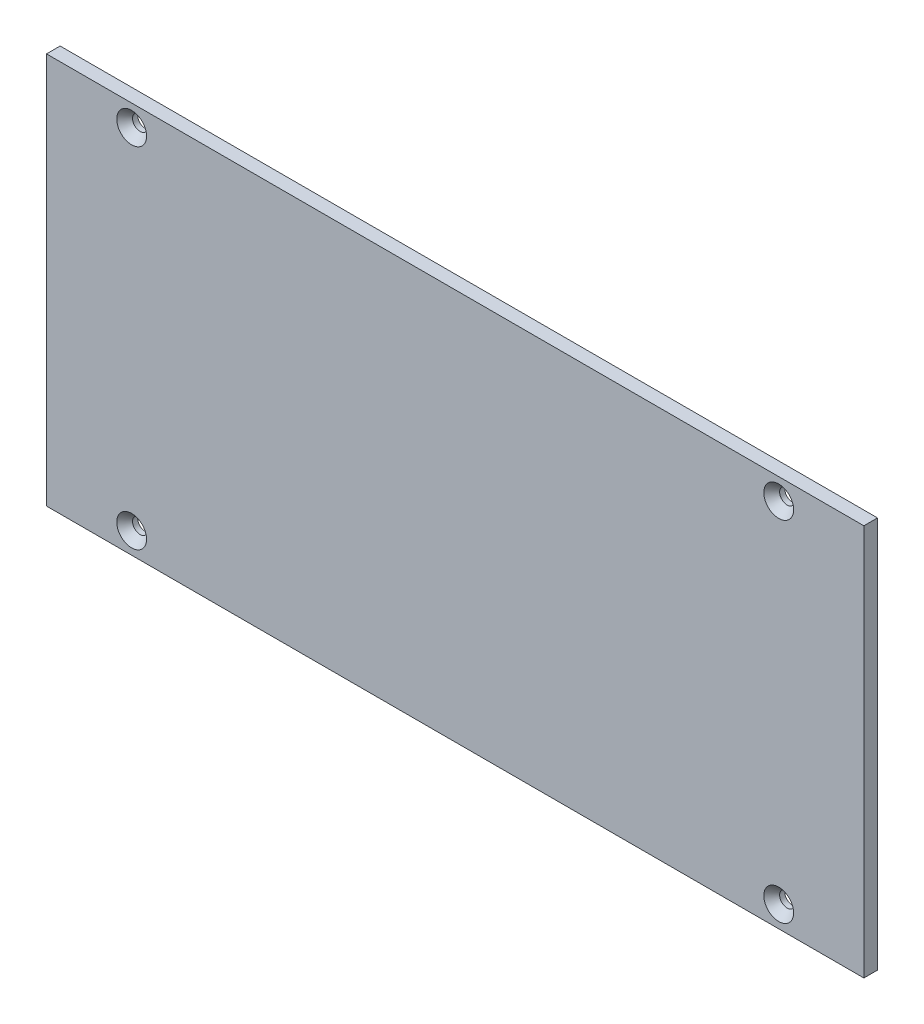
from build123d import *

# Parameters (mm, degrees)
SKETCH1_W                                     = 96
SKETCH1_H                                     = 46
BOSS_EXTRUDE1_DEPTH                           = 1.6002
CSK_FOR_0_FLAT_HEAD_SOCKET_CAP_SCREW1_A_COUNT = 2
CSK_FOR_0_FLAT_HEAD_SOCKET_CAP_SCREW1_A_PITCH = 41
CSK_FOR_0_FLAT_HEAD_SOCKET_CAP_SCRE_2_COUNT   = 2
CSK_FOR_0_FLAT_HEAD_SOCKET_CAP_SCRE_2_PITCH   = 86.353922899
CSK_FOR_0_FLAT_HEAD_SOCKET_CAP_SCRE_3_COUNT   = 2
CSK_FOR_0_FLAT_HEAD_SOCKET_CAP_SCRE_3_PITCH   = 76


with BuildPart() as part:
    # Sketch1 → Boss-Extrude1 (new body)
    with BuildSketch(Plane.XY):
        with Locations((48, 23)):
            Rectangle(SKETCH1_W, SKETCH1_H)
    extrude(amount=BOSS_EXTRUDE1_DEPTH)

    # Sketch7 → CSK for #0 Flat Head Socket Cap Screw1 (revolve, cut)
    with BuildSketch(Plane(origin=(10, 43.5, 1.6002), x_dir=(0, -1, 0), z_dir=(1, 0, 0))):
        Polygon((0, 0), (0, 1.6002), (0.889, 1.6002), (0.889, 0.993458156), (1.7526, 0), align=None)
    csk_for_0_flat_head_socket_cap_screw1 = revolve(axis=Axis((10, 43.5, 7.9502), (0, 0, -1)), mode=Mode.SUBTRACT)

    # CSK for #0 Flat Head Socket Cap Screw1 a: CSK for #0 Flat Head Socket Cap Screw1 ×2
    with Locations(*[(0, -i * CSK_FOR_0_FLAT_HEAD_SOCKET_CAP_SCREW1_A_PITCH, 0) for i in range(1, CSK_FOR_0_FLAT_HEAD_SOCKET_CAP_SCREW1_A_COUNT)]):
        add(csk_for_0_flat_head_socket_cap_screw1, mode=Mode.SUBTRACT)

    # CSK for _0 Flat Head Socket Cap Scre 2: CSK for #0 Flat Head Socket Cap Screw1 ×2
    with Locations(*[Vector(0.8800989862281838, -0.47479024257046726, 0) * (i * CSK_FOR_0_FLAT_HEAD_SOCKET_CAP_SCRE_2_PITCH) for i in range(1, CSK_FOR_0_FLAT_HEAD_SOCKET_CAP_SCRE_2_COUNT)]):
        add(csk_for_0_flat_head_socket_cap_screw1, mode=Mode.SUBTRACT)

    # CSK for _0 Flat Head Socket Cap Scre 3: CSK for #0 Flat Head Socket Cap Screw1 ×2
    with Locations(*[(i * CSK_FOR_0_FLAT_HEAD_SOCKET_CAP_SCRE_3_PITCH, 0, 0) for i in range(1, CSK_FOR_0_FLAT_HEAD_SOCKET_CAP_SCRE_3_COUNT)]):
        add(csk_for_0_flat_head_socket_cap_screw1, mode=Mode.SUBTRACT)


solid = part.part
